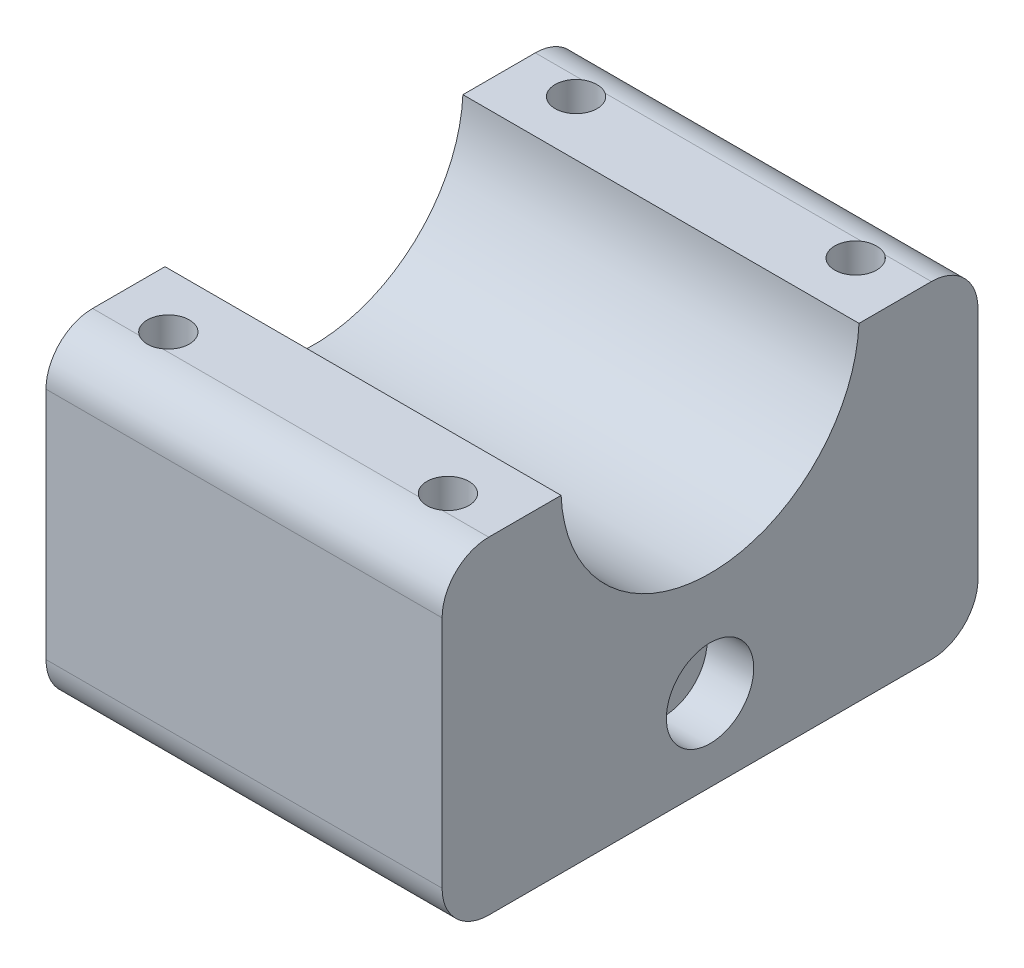
from build123d import *

# Parameters (mm, degrees)
BOSS_EXTRUDE1_DEPTH     = 17
CUT_EXTRUDE1_DEPTH      = 41.517773878
CUT_EXTRUDE1_DEPTH_BACK = 41.517773878
SKETCH2_R               = 12.8
SKETCH3_R               = 1.8
CUT_EXTRUDE2_DEPTH      = 28.5
SKETCH4_R               = 3.25
CUT_EXTRUDE3_DEPTH      = 15.3
SKETCH5_R               = 12.85
CUT_EXTRUDE4_DEPTH      = 14
CUT_EXTRUDE5_DEPTH      = 41.517774047
CUT_EXTRUDE5_DEPTH_BACK = 41.517774047
SKETCH6_R               = 1.8
SKETCH7_R               = 3.75
CUT_EXTRUDE6_DEPTH      = 4
CUT_EXTRUDE7_DEPTH      = 4.3


with BuildPart() as part:
    # Sketch1 → Boss-Extrude1 (new, symmetric)
    with BuildSketch(Plane(origin=(0, 0, 0), x_dir=(0, 0, -1), z_dir=(1, 0, 0))):
        with BuildLine():
            Line((-19, -28.7), (19, -28.7))
            ThreePointArc((19, -28.7), (21.828427125, -27.528427125), (23, -24.7))
            Line((23, -24.7), (23, -4.6))
            ThreePointArc((23, -4.6), (21.828427125, -1.771572875), (19, -0.6))
            Line((19, -0.6), (-19, -0.6))
            ThreePointArc((-19, -0.6), (-21.828427125, -1.771572875), (-23, -4.6))
            Line((-23, -4.6), (-23, -24.7))
            ThreePointArc((-23, -24.7), (-21.828427125, -27.528427125), (-19, -28.7))
        make_face()
    extrude(amount=BOSS_EXTRUDE1_DEPTH, both=True)

    # Sketch2 → Cut-Extrude1 (cut, two sides: drawn at the far end of the back side and taken through both)
    with BuildSketch(Plane(origin=(0, 0, 0), x_dir=(0, 0, -1), z_dir=(1, 0, 0)).offset(-CUT_EXTRUDE1_DEPTH_BACK)):
        Circle(SKETCH2_R)
    extrude(amount=CUT_EXTRUDE1_DEPTH + CUT_EXTRUDE1_DEPTH_BACK, mode=Mode.SUBTRACT)

    # Sketch3 → Cut-Extrude2 (cut)
    with BuildSketch(Plane(origin=(0, -28.7, 0), x_dir=(1, 0, 0), z_dir=(0, 1, 0))):
        with Locations((12, -17.5)):
            Circle(SKETCH3_R)
        with Locations((12, 17.5)):
            Circle(SKETCH3_R)
        with Locations((-12, -17.5)):
            Circle(SKETCH3_R)
        with Locations((-12, 17.5)):
            Circle(SKETCH3_R)
    extrude(amount=CUT_EXTRUDE2_DEPTH, mode=Mode.SUBTRACT)

    # Sketch4 → Cut-Extrude3 (cut)
    with BuildSketch(Plane(origin=(0, -28.7, 0), x_dir=(1, 0, 0), z_dir=(0, 1, 0))):
        with Locations((12, -17.5)):
            Circle(SKETCH4_R)
        with Locations((12, 17.5)):
            Circle(SKETCH4_R)
        with Locations((-12, -17.5)):
            Circle(SKETCH4_R)
        with Locations((-12, 17.5)):
            Circle(SKETCH4_R)
    extrude(amount=CUT_EXTRUDE3_DEPTH, mode=Mode.SUBTRACT)

    # Sketch5 → Cut-Extrude4 (cut)
    with BuildSketch(Plane(origin=(0, -28.7, 0), x_dir=(1, 0, 0), z_dir=(0, 1, 0))):
        Circle(SKETCH5_R)
    extrude(amount=CUT_EXTRUDE4_DEPTH, mode=Mode.SUBTRACT)

    # Sketch6 → Cut-Extrude5 (cut, two sides: drawn at the far end of the back side and taken through both)
    with BuildSketch(Plane(origin=(0, 0, 0), x_dir=(0, 0, -1), z_dir=(1, 0, 0)).offset(-CUT_EXTRUDE5_DEPTH_BACK)):
        with Locations((0, -21.7)):
            Circle(SKETCH6_R)
    extrude(amount=CUT_EXTRUDE5_DEPTH + CUT_EXTRUDE5_DEPTH_BACK, mode=Mode.SUBTRACT)

    # Sketch7 → Cut-Extrude6 (cut)
    with BuildSketch(Plane(origin=(17, 0, 0), x_dir=(0, 0, -1), z_dir=(1, 0, 0))):
        with Locations((0, -21.7)):
            Circle(SKETCH7_R)
    extrude(amount=-CUT_EXTRUDE6_DEPTH, mode=Mode.SUBTRACT)

    # Sketch8 → Cut-Extrude7 (cut)
    with BuildSketch(Plane(origin=(-17, 0, 0), x_dir=(0, 0, -1), z_dir=(1, 0, 0))):
        Polygon((-2.85, -20.054551733), (0, -18.409103466), (2.85, -20.054551733), (2.85, -23.345448267), (0, -24.990896534), (-2.85, -23.345448267), align=None)
    extrude(amount=CUT_EXTRUDE7_DEPTH, mode=Mode.SUBTRACT)


solid = part.part
